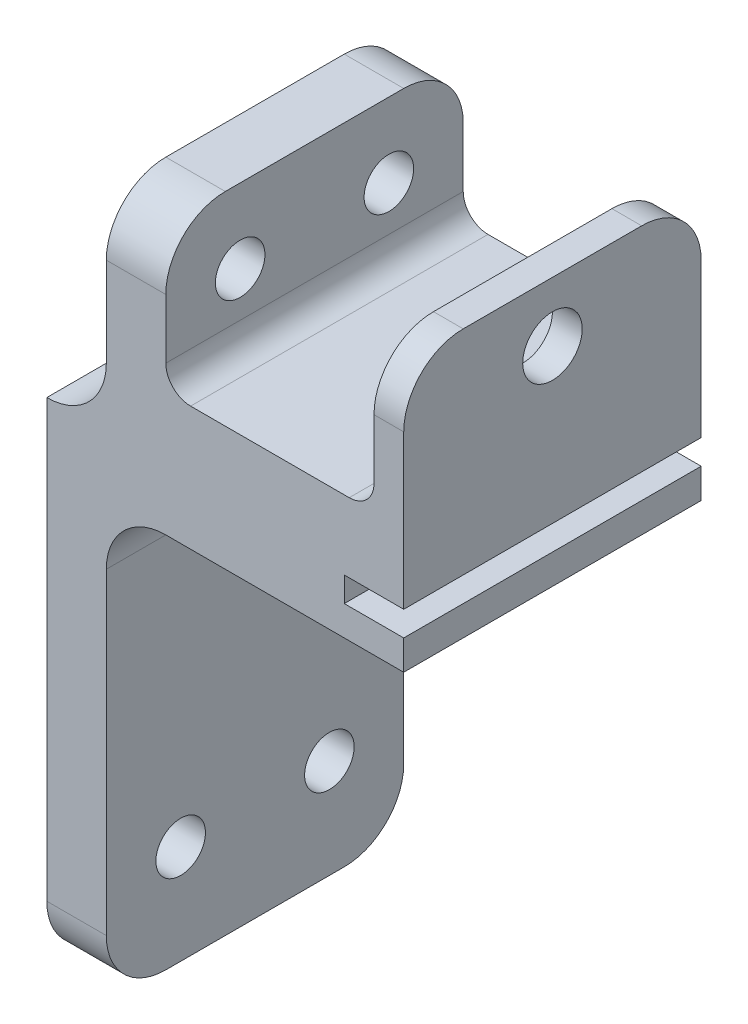
from build123d import *

# Parameters (mm, degrees)
BOSS_EXTRUDE1_DEPTH = 60
FILLET1_R           = 12
FILLET2_R           = 12
CUT_EXTRUDE1_REACH  = 130.561
SKETCH4_R           = 5
CUT_EXTRUDE2_REACH  = 130.561
SKETCH5_R           = 6


with BuildPart() as part:
    # Sketch2 → Boss-Extrude1 (new body)
    with BuildSketch(Plane.XY):
        with BuildLine():
            Line((0, -12), (0, -88))
            Line((0, -88), (-12, -88))
            Line((-12, -88), (-12, 12))
            Line((-12, 12), (0, 12))
            Line((0, 12), (0, 54))
            Line((0, 54), (12, 54))
            Line((12, 54), (12, 30))
            ThreePointArc((12, 30), (13.464466094, 26.464466094), (17, 25))
            Line((17, 25), (49, 25))
            ThreePointArc((49, 25), (52.535533906, 26.464466094), (54, 30))
            Line((54, 30), (54, 54))
            Line((54, 54), (60, 54))
            Line((60, 54), (60, 11))
            Line((60, 11), (48, 11))
            Line((48, 11), (48, 6))
            Line((48, 6), (60, 6))
            Line((60, 6), (60, 0))
            Line((60, 0), (12, 0))
            ThreePointArc((12, 0), (3.514718626, -3.514718626), (0, -12))
        make_face()
    extrude(amount=BOSS_EXTRUDE1_DEPTH)

    # Fillet1
    fillet1_edges = [part.edges().sort_by_distance(p)[0] for p in [
        (0, 12, 30),
    ]]
    fillet(fillet1_edges, radius=FILLET1_R - 0.0001)  # a hair under: the kernel refuses the full size

    # Fillet2
    fillet2_edges = [part.edges().sort_by_distance(p)[0] for p in [
        (6, 54, 0),
        (57, 54, 0),
        (-6, -88, 0),
        (57, 54, 60),
        (-6, -88, 60),
        (6, 54, 60),
    ]]
    fillet(fillet2_edges, radius=FILLET2_R)

    # Sketch4 → Cut-Extrude1 (cut, up to next)
    with BuildSketch(Plane.ZY.offset(12), mode=Mode.PRIVATE) as cut_extrude1_sk1:
        with Locations(Location((15, -68, 0), (0, 0, 270))):
            Circle(SKETCH4_R)
    cut_extrude1_tool1 = extrude(cut_extrude1_sk1.sketch, amount=-CUT_EXTRUDE1_REACH, mode=Mode.PRIVATE) & part.part
    # Sketch4 → Cut-Extrude1 (cut, up to next)
    with BuildSketch(Plane.ZY.offset(12), mode=Mode.PRIVATE) as cut_extrude1_sk2:
        with Locations(Location((45, -68, 0), (0, 0, 270))):
            Circle(SKETCH4_R)
    cut_extrude1_tool2 = extrude(cut_extrude1_sk2.sketch, amount=-CUT_EXTRUDE1_REACH, mode=Mode.PRIVATE) & part.part
    # Sketch4 → Cut-Extrude1 (cut, up to next)
    with BuildSketch(Plane.ZY.offset(12), mode=Mode.PRIVATE) as cut_extrude1_sk3:
        with Locations(Location((15, 39, 0), (0, 0, 270))):
            Circle(SKETCH4_R)
    cut_extrude1_tool3 = extrude(cut_extrude1_sk3.sketch, amount=-CUT_EXTRUDE1_REACH, mode=Mode.PRIVATE) & part.part
    # Sketch4 → Cut-Extrude1 (cut, up to next)
    with BuildSketch(Plane.ZY.offset(12), mode=Mode.PRIVATE) as cut_extrude1_sk4:
        with Locations(Location((45, 39, 0), (0, 0, 270))):
            Circle(SKETCH4_R)
    cut_extrude1_tool4 = extrude(cut_extrude1_sk4.sketch, amount=-CUT_EXTRUDE1_REACH, mode=Mode.PRIVATE) & part.part
    add(cut_extrude1_tool1.solids().sort_by_distance((-12, -68, 15))[0], mode=Mode.SUBTRACT)
    add(cut_extrude1_tool2.solids().sort_by_distance((-12, -68, 45))[0], mode=Mode.SUBTRACT)
    add(cut_extrude1_tool3.solids().sort_by_distance((-12, 39, 15))[0], mode=Mode.SUBTRACT)
    add(cut_extrude1_tool4.solids().sort_by_distance((-12, 39, 45))[0], mode=Mode.SUBTRACT)

    # Sketch5 → Cut-Extrude2 (cut, up to next)
    with BuildSketch(Plane(origin=(60, 0, 0), x_dir=(0, 0, -1), z_dir=(1, 0, 0)), mode=Mode.PRIVATE) as cut_extrude2_sk1:
        with Locations(Location((-30, 42, 0), (0, 0, 90))):
            Circle(SKETCH5_R)
    cut_extrude2_tool1 = extrude(cut_extrude2_sk1.sketch, amount=-CUT_EXTRUDE2_REACH, mode=Mode.PRIVATE) & part.part
    add(cut_extrude2_tool1.solids().sort_by_distance((60, 42, 30))[0], mode=Mode.SUBTRACT)


solid = part.part
